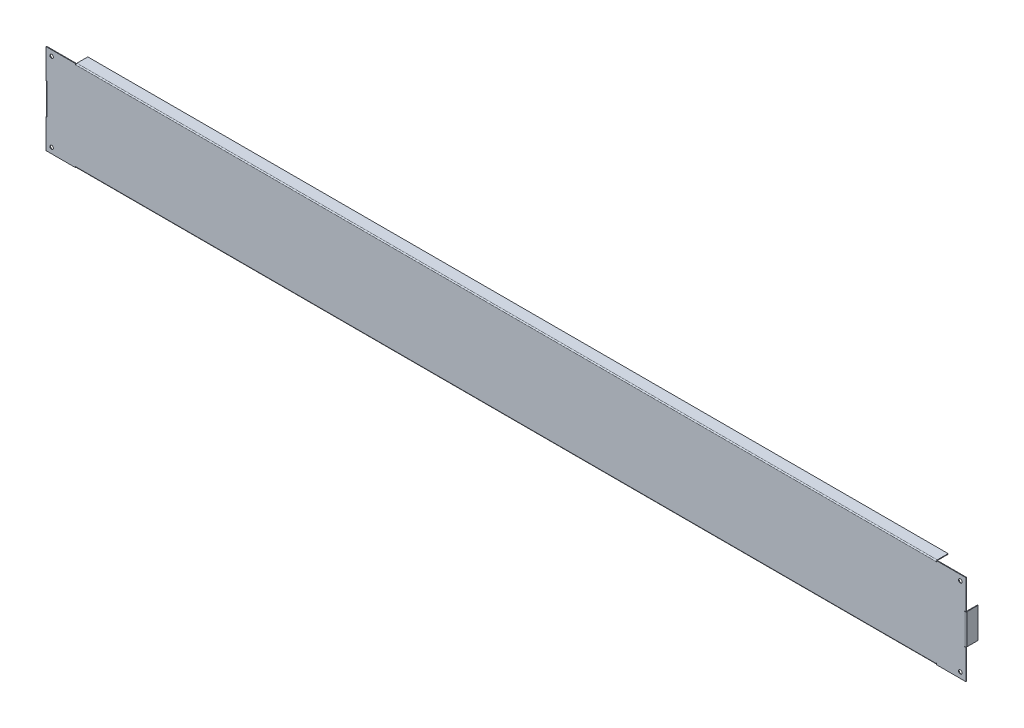
from build123d import *

# Parameters (mm, degrees)
SKETCH_1_W                        = 1541
SKETCH_1_H                        = 151
SM_BASE_FLANGE_1_DEPTH            = 1
SM_EDGE_FLANGE_1_STRIP_W          = 5.4732
SM_EDGE_FLANGE_1_STRIP_H          = 1
SM_EDGE_FLANGE_1_STRIP_CUT_DEPTH  = 1441
SM_EDGE_FLANGE_1_RELIEF_W         = 5.9732
SM_EDGE_FLANGE_1_RELIEF_H         = 0.5
SM_EDGE_FLANGE_1_RELIEF_CUT_DEPTH = 1
SM_EDGE_FLANGE_1_DEPTH            = 1441
SM_EDGE_FLANGE_2_STRIP_W          = 5.4732
SM_EDGE_FLANGE_2_STRIP_H          = 1
SM_EDGE_FLANGE_2_STRIP_CUT_DEPTH  = 1441
SM_EDGE_FLANGE_2_RELIEF_W         = 5.9732
SM_EDGE_FLANGE_2_RELIEF_H         = 0.5
SM_EDGE_FLANGE_2_RELIEF_CUT_DEPTH = 1
SM_EDGE_FLANGE_2_DEPTH            = 1441
SM_EDGE_FLANGE_3_STRIP_W          = 5.4732
SM_EDGE_FLANGE_3_STRIP_H          = 1
SM_EDGE_FLANGE_3_STRIP_CUT_DEPTH  = 51
SM_EDGE_FLANGE_3_RELIEF_W         = 5.9732
SM_EDGE_FLANGE_3_RELIEF_H         = 0.5
SM_EDGE_FLANGE_3_RELIEF_CUT_DEPTH = 1
SM_EDGE_FLANGE_3_DEPTH            = 51
SM_EDGE_FLANGE_4_STRIP_W          = 5.4732
SM_EDGE_FLANGE_4_STRIP_H          = 1
SM_EDGE_FLANGE_4_STRIP_CUT_DEPTH  = 51
SM_EDGE_FLANGE_4_RELIEF_W         = 5.9732
SM_EDGE_FLANGE_4_RELIEF_H         = 0.5
SM_EDGE_FLANGE_4_RELIEF_CUT_DEPTH = 1
SM_EDGE_FLANGE_4_DEPTH            = 51
SKETCH_15_R                       = 3
CUT_EXTRUDE_1_DEPTH               = 775.44851346


# Sheet-metal steps are written as plain solids
with BuildPart() as part:
    # Sketch 1 → 基体-法兰1 (new body)
    with BuildSketch(Plane.XY):
        Rectangle(SKETCH_1_W, SKETCH_1_H)
    extrude(amount=-SM_BASE_FLANGE_1_DEPTH)

    # 边线-法兰1 strip (across the edge) → 边线-法兰1 strip cut (cut)
    with BuildSketch(Plane(origin=(-720.5, 75.5, -1), x_dir=(0, -1, 0), z_dir=(1, 0, 0))):
        with Locations((-1, -0.5)):
            Rectangle(SM_EDGE_FLANGE_1_STRIP_W, SM_EDGE_FLANGE_1_STRIP_H)
    extrude(amount=SM_EDGE_FLANGE_1_STRIP_CUT_DEPTH, mode=Mode.SUBTRACT)

    # 边线-法兰1 relief (on the sheet) → 边线-法兰1 relief cut (cut)
    with BuildSketch(Plane(origin=(-720.5, 73.7634, -1), x_dir=(0, -1, 0), z_dir=(0, 0, -1))):
        with Locations((-2.4866, 0.25)):
            Rectangle(SM_EDGE_FLANGE_1_RELIEF_W, SM_EDGE_FLANGE_1_RELIEF_H)
        with Locations((-2.4866, -1441.25)):
            Rectangle(SM_EDGE_FLANGE_1_RELIEF_W, SM_EDGE_FLANGE_1_RELIEF_H)
    extrude(amount=-SM_EDGE_FLANGE_1_RELIEF_CUT_DEPTH, mode=Mode.SUBTRACT)

    # 边线-法兰1 section (across the edge) → 边线-法兰1 (add)
    with BuildSketch(Plane(origin=(-720.5, 75.5, -1), x_dir=(0, -1, 0), z_dir=(1, 0, 0))):
        with BuildLine():
            Line((0, 0.7366), (0, 19))
            Line((0, 19), (1, 19))
            Line((1, 19), (1, 0.7366))
            ThreePointArc((1, 0.7366), (1.215745145, 0.215745145), (1.7366, 0))
            Line((1.7366, 0), (1.7366, -1))
            ThreePointArc((1.7366, -1), (0.508638364, -0.491361636), (0, 0.7366))
        make_face()
    extrude(amount=SM_EDGE_FLANGE_1_DEPTH)

    # 边线-法兰2 strip (across the edge) → 边线-法兰2 strip cut (cut)
    with BuildSketch(Plane(origin=(720.5, -75.5, -1), x_dir=(0, 1, 0), z_dir=(-1, 0, 0))):
        with Locations((-1, -0.5)):
            Rectangle(SM_EDGE_FLANGE_2_STRIP_W, SM_EDGE_FLANGE_2_STRIP_H)
    extrude(amount=SM_EDGE_FLANGE_2_STRIP_CUT_DEPTH, mode=Mode.SUBTRACT)

    # 边线-法兰2 relief (on the sheet) → 边线-法兰2 relief cut (cut)
    with BuildSketch(Plane(origin=(720.5, -73.7634, -1), x_dir=(0, 1, 0), z_dir=(0, 0, -1))):
        with Locations((-2.4866, 0.25)):
            Rectangle(SM_EDGE_FLANGE_2_RELIEF_W, SM_EDGE_FLANGE_2_RELIEF_H)
        with Locations((-2.4866, -1441.25)):
            Rectangle(SM_EDGE_FLANGE_2_RELIEF_W, SM_EDGE_FLANGE_2_RELIEF_H)
    extrude(amount=-SM_EDGE_FLANGE_2_RELIEF_CUT_DEPTH, mode=Mode.SUBTRACT)

    # 边线-法兰2 section (across the edge) → 边线-法兰2 (add)
    with BuildSketch(Plane(origin=(720.5, -75.5, -1), x_dir=(0, 1, 0), z_dir=(-1, 0, 0))):
        with BuildLine():
            Line((0, 0.7366), (0, 19))
            Line((0, 19), (1, 19))
            Line((1, 19), (1, 0.7366))
            ThreePointArc((1, 0.7366), (1.215745145, 0.215745145), (1.7366, 0))
            Line((1.7366, 0), (1.7366, -1))
            ThreePointArc((1.7366, -1), (0.508638364, -0.491361636), (0, 0.7366))
        make_face()
    extrude(amount=SM_EDGE_FLANGE_2_DEPTH)

    # 边线-法兰3 strip (across the edge) → 边线-法兰3 strip cut (cut)
    with BuildSketch(Plane(origin=(770.5, 25.5, -1), x_dir=(-1, 0, 0), z_dir=(0, -1, 0))):
        with Locations((-1, -0.5)):
            Rectangle(SM_EDGE_FLANGE_3_STRIP_W, SM_EDGE_FLANGE_3_STRIP_H)
    extrude(amount=SM_EDGE_FLANGE_3_STRIP_CUT_DEPTH, mode=Mode.SUBTRACT)

    # 边线-法兰3 relief (on the sheet) → 边线-法兰3 relief cut (cut)
    with BuildSketch(Plane(origin=(768.7634, 25.5, -1), x_dir=(-1, 0, 0), z_dir=(0, 0, -1))):
        with Locations((-2.4866, 0.25)):
            Rectangle(SM_EDGE_FLANGE_3_RELIEF_W, SM_EDGE_FLANGE_3_RELIEF_H)
        with Locations((-2.4866, -51.25)):
            Rectangle(SM_EDGE_FLANGE_3_RELIEF_W, SM_EDGE_FLANGE_3_RELIEF_H)
    extrude(amount=-SM_EDGE_FLANGE_3_RELIEF_CUT_DEPTH, mode=Mode.SUBTRACT)

    # 边线-法兰3 section (across the edge) → 边线-法兰3 (add)
    with BuildSketch(Plane(origin=(770.5, 25.5, -1), x_dir=(-1, 0, 0), z_dir=(0, -1, 0))):
        with BuildLine():
            Line((0, 0.7366), (0, 19))
            Line((0, 19), (1, 19))
            Line((1, 19), (1, 0.7366))
            ThreePointArc((1, 0.7366), (1.215745145, 0.215745145), (1.7366, 0))
            Line((1.7366, 0), (1.7366, -1))
            ThreePointArc((1.7366, -1), (0.508638364, -0.491361636), (0, 0.7366))
        make_face()
    extrude(amount=SM_EDGE_FLANGE_3_DEPTH)

    # 边线-法兰4 strip (across the edge) → 边线-法兰4 strip cut (cut)
    with BuildSketch(Plane(origin=(-770.5, -25.5, -1), x_dir=(1, 0, 0), z_dir=(0, 1, 0))):
        with Locations((-1, -0.5)):
            Rectangle(SM_EDGE_FLANGE_4_STRIP_W, SM_EDGE_FLANGE_4_STRIP_H)
    extrude(amount=SM_EDGE_FLANGE_4_STRIP_CUT_DEPTH, mode=Mode.SUBTRACT)

    # 边线-法兰4 relief (on the sheet) → 边线-法兰4 relief cut (cut)
    with BuildSketch(Plane(origin=(-768.7634, -25.5, -1), x_dir=(1, 0, 0), z_dir=(0, 0, -1))):
        with Locations((-2.4866, 0.25)):
            Rectangle(SM_EDGE_FLANGE_4_RELIEF_W, SM_EDGE_FLANGE_4_RELIEF_H)
        with Locations((-2.4866, -51.25)):
            Rectangle(SM_EDGE_FLANGE_4_RELIEF_W, SM_EDGE_FLANGE_4_RELIEF_H)
    extrude(amount=-SM_EDGE_FLANGE_4_RELIEF_CUT_DEPTH, mode=Mode.SUBTRACT)

    # 边线-法兰4 section (across the edge) → 边线-法兰4 (add)
    with BuildSketch(Plane(origin=(-770.5, -25.5, -1), x_dir=(1, 0, 0), z_dir=(0, 1, 0))):
        with BuildLine():
            Line((0, 0.7366), (0, 19))
            Line((0, 19), (1, 19))
            Line((1, 19), (1, 0.7366))
            ThreePointArc((1, 0.7366), (1.215745145, 0.215745145), (1.7366, 0))
            Line((1.7366, 0), (1.7366, -1))
            ThreePointArc((1.7366, -1), (0.508638364, -0.491361636), (0, 0.7366))
        make_face()
    extrude(amount=SM_EDGE_FLANGE_4_DEPTH)

    # 草图15 → 切除-拉伸1 (cut, through all)
    with BuildSketch(Plane.XY):
        with Locations((761, 66)):
            Circle(SKETCH_15_R)
        with Locations((761, -66)):
            Circle(SKETCH_15_R)
        with Locations((-761, 66)):
            Circle(SKETCH_15_R)
        with Locations((-761, -66)):
            Circle(SKETCH_15_R)
    extrude(amount=-CUT_EXTRUDE_1_DEPTH, mode=Mode.SUBTRACT)


solid = part.part
